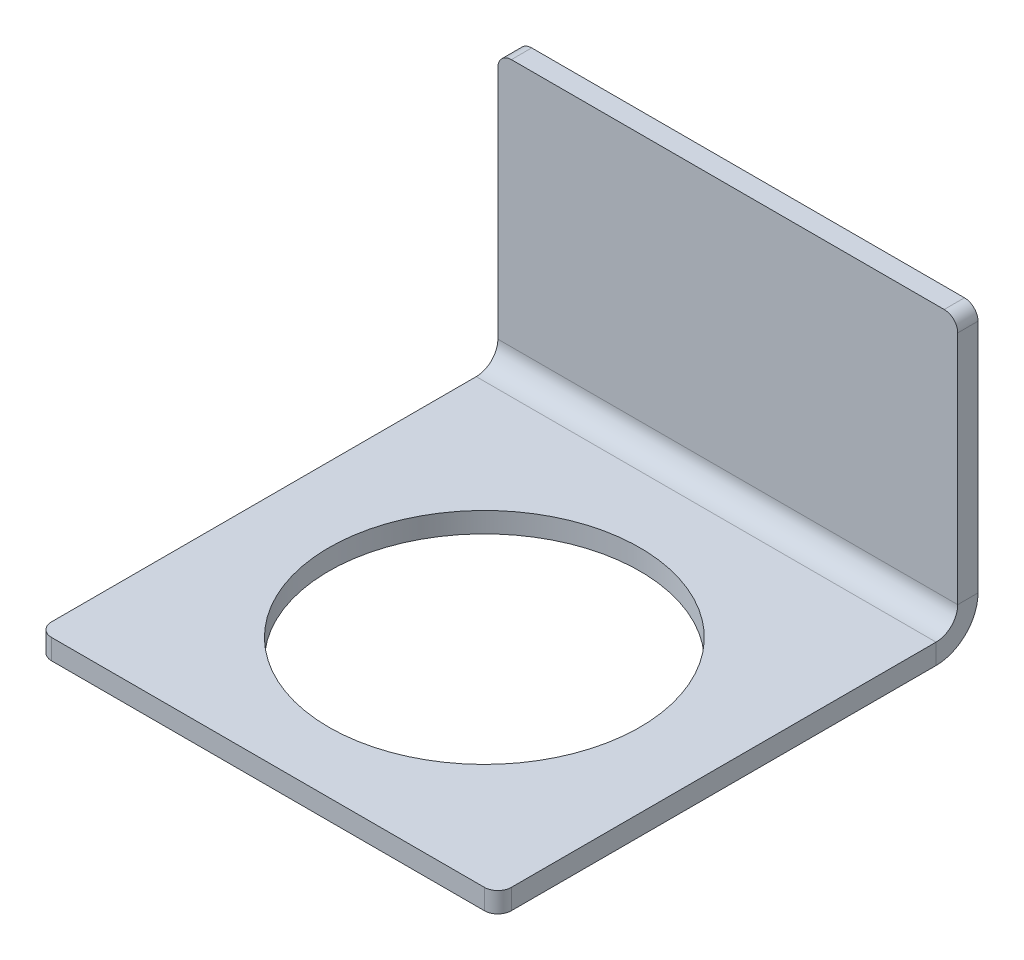
from build123d import *

# Parameters (mm, degrees)
SM_BASE_FLANGE_1_DEPTH = 17
SKETCH_6_R             = 11.5
CUT_EXTRUDE_1_DEPTH    = 43.95346319
FILLET_1_R             = 1


# Sheet-metal steps are written as plain solids
with BuildPart() as part:
    # Sketch 1 → Базовая кромка1 (new, symmetric)
    with BuildSketch(Plane(origin=(0, 0, 0), x_dir=(0, 0, -1), z_dir=(1, 0, 0))):
        with BuildLine():
            Line((-34, 0), (-1.6, 0))
            ThreePointArc((-1.6, 0), (-0.46862915, 0.46862915), (0, 1.6))
            Line((0, 1.6), (0, 20))
            Line((0, 20), (1.5, 20))
            Line((1.5, 20), (1.5, 1.6))
            ThreePointArc((1.5, 1.6), (0.592031022, -0.592031022), (-1.6, -1.5))
            Line((-1.6, -1.5), (-34, -1.5))
            Line((-34, -1.5), (-34, 0))
        make_face()
    extrude(amount=SM_BASE_FLANGE_1_DEPTH, both=True)

    # Эскиз6 → Вырез-Вытянуть1 (cut, through all)
    with BuildSketch(Plane(origin=(0, 0, 0), x_dir=(1, 0, 0), z_dir=(0, 1, 0))):
        with Locations(Location((0, -18, 0), (0, 0, 270))):
            Circle(SKETCH_6_R)
    extrude(amount=-CUT_EXTRUDE_1_DEPTH, mode=Mode.SUBTRACT)

    # Скругление1
    fillet_1_edges = [part.edges().sort_by_distance(p)[0] for p in [
        (17, -0.75, 34),
        (17, 20, -0.75),
        (-17, -0.75, 34),
        (-17, 20, -0.75),
    ]]
    fillet(fillet_1_edges, radius=FILLET_1_R)


solid = part.part
